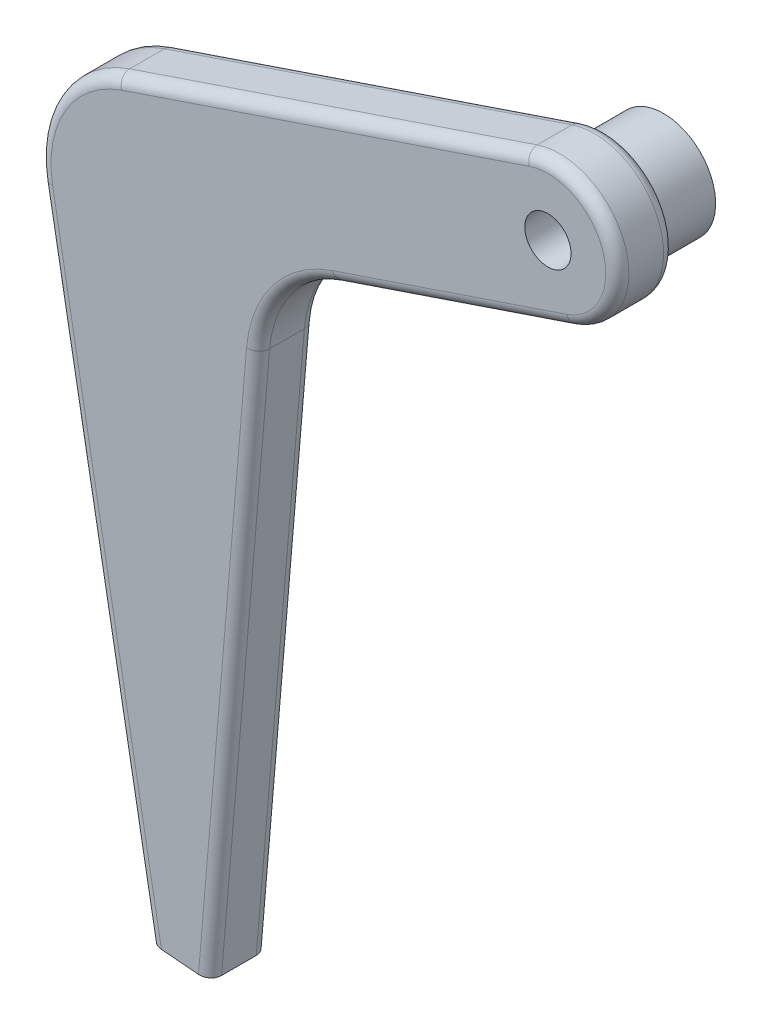
from build123d import *

# Parameters (mm, degrees)
SKETCH1_R           = 2
BOSS_EXTRUDE1_DEPTH = 2.5
FILLET1_R           = 1
SKETCH3_R           = 4.5
BOSS_EXTRUDE2_DEPTH = 5
SKETCH4_R           = 2.5
CUT_EXTRUDE1_DEPTH  = 3
SKETCH5_R           = 1.1
CUT_EXTRUDE2_DEPTH  = 3


with BuildPart() as part:
    # Sketch1 → Boss-Extrude1 (new, symmetric)
    with BuildSketch(Plane.XY):
        with BuildLine():
            Line((-8.07667743, -55.683381942), (-28.300726773, -62.527435526))
            ThreePointArc((-28.300726773, -62.527435526), (-32.967187399, -65.832758653), (-35.059424641, -71.154746916))
            Line((-35.059424641, -71.154746916), (-39.215218896, -120.160323437))
            Line((-39.215218896, -120.160323437), (-44.446651532, -119.716684994))
            Line((-44.446651532, -119.716684994), (-53.801536863, -67.477396645))
            ThreePointArc((-53.801536863, -67.477396645), (-52.567729124, -60.627943396), (-47.163662103, -56.242358944))
            Line((-47.163662103, -56.242358944), (-11.92332257, -44.316618058))
            ThreePointArc((-11.92332257, -44.316618058), (-4.316618058, -48.07667743), (-8.07667743, -55.683381942))
        make_face()
        with Locations((-10, -50)):
            Circle(SKETCH1_R, mode=Mode.SUBTRACT)
    extrude(amount=BOSS_EXTRUDE1_DEPTH, both=True)

    # Fillet1
    fillet1_edges = [part.edges().sort_by_distance(p)[0] for p in [
        (-37.137321769, -95.657535177, -2.5),
        (-32.967187399, -65.832758653, -2.5),
        (-49.124094197, -93.59704082, -2.5),
        (-52.567729124, -60.627943396, -2.5),
        (-29.543492336, -50.279488501, -2.5),
        (-4.316618058, -48.07667743, -2.5),
        (-37.137321769, -95.657535177, 2.5),
        (-32.967187399, -65.832758653, 2.5),
        (-49.124094197, -93.59704082, 2.5),
        (-52.567729124, -60.627943396, 2.5),
        (-29.543492336, -50.279488501, 2.5),
        (-4.316618058, -48.07667743, 2.5),
        (-18.188702102, -59.105408734, -2.5),
        (-18.188702102, -59.105408734, 2.5),
    ]]
    fillet(fillet1_edges, radius=FILLET1_R)

    # Sketch3 → Boss-Extrude2 (add)
    with BuildSketch(Plane(origin=(0, 0, -2.5), x_dir=(-1, 0, 0), z_dir=(0, 0, -1))):
        with Locations((10, -50)):
            Circle(SKETCH3_R)
    extrude(amount=BOSS_EXTRUDE2_DEPTH)

    # Sketch4 → Cut-Extrude1 (cut)
    with BuildSketch(Plane(origin=(0, 0, -7.5), x_dir=(-1, 0, 0), z_dir=(0, 0, -1))):
        with Locations((10, -50)):
            Circle(SKETCH4_R)
    extrude(amount=-CUT_EXTRUDE1_DEPTH, mode=Mode.SUBTRACT)

    # Sketch5 → Cut-Extrude2 (cut)
    with BuildSketch(Plane.XY.offset(-2.5)):
        with Locations((-10, -50)):
            Circle(SKETCH5_R)
    extrude(amount=-CUT_EXTRUDE2_DEPTH, mode=Mode.SUBTRACT)


solid = part.part
